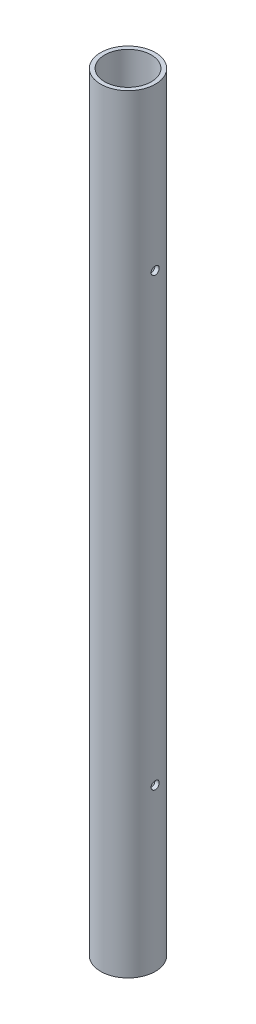
from build123d import *

# Parameters (mm, degrees)
SKETCH1_W             = 1.651
SKETCH1_H             = 311.912
F_4_CLEARANCE_HOLE1_D = 3.2639


with BuildPart() as part:
    # Sketch1 → Revolve1 (revolve)
    with BuildSketch(Plane.XY):
        with Locations((10.287, 0)):
            Rectangle(SKETCH1_W, SKETCH1_H)
    revolve(axis=Axis((0, -69.190661529, 0), (0, 1, 0)))

    # #4 Clearance Hole1 (through all)
    with Locations(Plane(origin=(11.1125, 0, 0), x_dir=(0, 0, -1), z_dir=(1, 0, 0))):
        with Locations((0, 90.45448), (0, -90.45448)):
            Hole(F_4_CLEARANCE_HOLE1_D / 2)


solid = part.part
